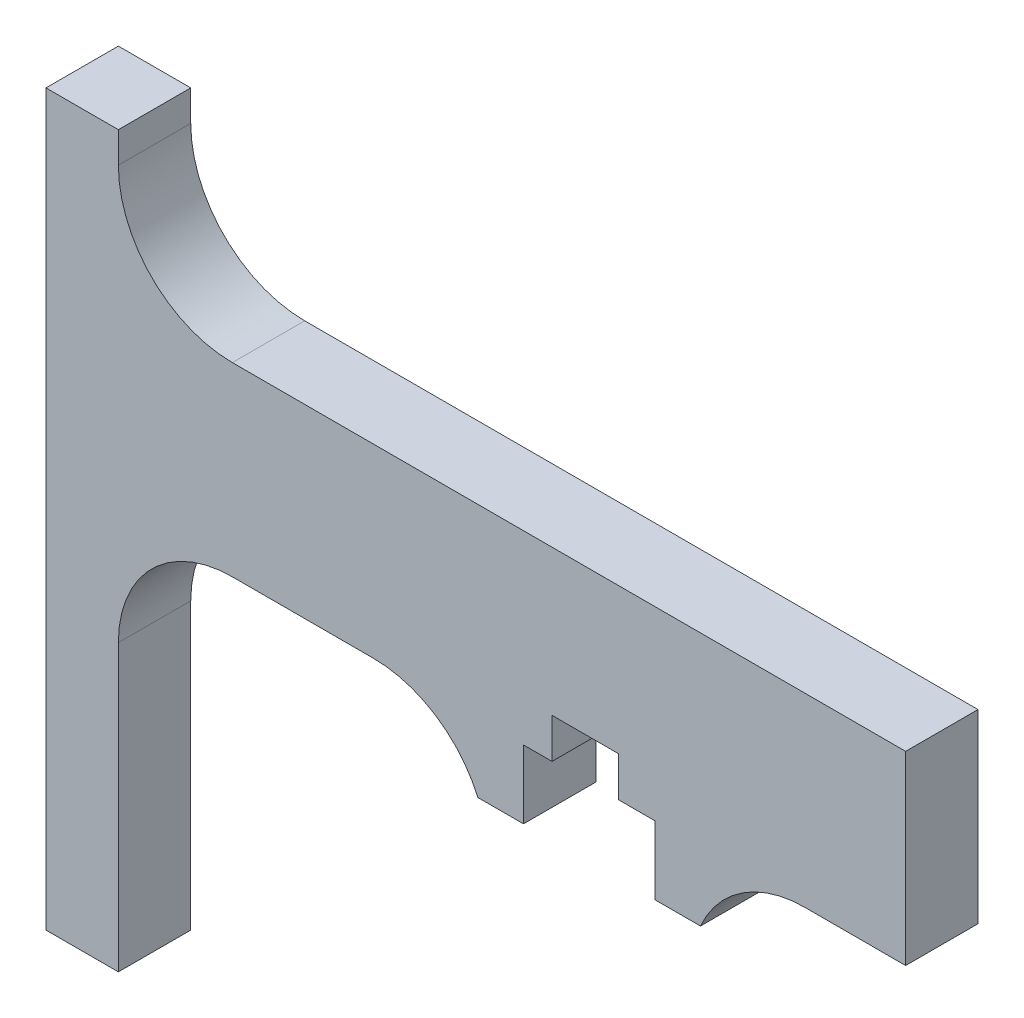
from build123d import *

# Parameters (mm, degrees)
BOSS_EXTRUDE1_DEPTH = 6.35
FILLET1_R           = 10
SKETCH3_W           = 4
SKETCH3_H           = 6
BOSS_EXTRUDE2_DEPTH = 6.35
FILLET2_R           = 10
SKETCH4_W           = 5.85
SKETCH4_H           = 3.5
CUT_EXTRUDE1_DEPTH  = 10


with BuildPart() as part:
    # Sketch2 → Boss-Extrude1 (new body)
    with BuildSketch(Plane.XY):
        Polygon((0, -45.00147748), (0, 0), (6.35, 0), (6.35, -12.7), (75.42710801, -12.7), (75.42710801, -28.978), (6.35, -28.978), (6.35, -63.9998), (0, -63.9998), align=None)
    extrude(amount=BOSS_EXTRUDE1_DEPTH)

    # Fillet1
    fillet1_edges = [part.edges().sort_by_distance(p)[0] for p in [
        (6.35, -12.7, 3.175),
        (6.35, -28.978, 3.175),
    ]]
    fillet(fillet1_edges, radius=FILLET1_R)

    # Sketch3 → Boss-Extrude2 (add)
    with BuildSketch(Plane(origin=(0, 0, 0), x_dir=(-1, 0, 0), z_dir=(0, 0, -1))):
        with Locations((-39.89710801, -31.978)):
            Rectangle(SKETCH3_W, SKETCH3_H)
        with Locations((-55.42710801, -31.978)):
            Rectangle(SKETCH3_W, SKETCH3_H)
    extrude(amount=-BOSS_EXTRUDE2_DEPTH)

    # Fillet2
    # the kernel refuses this fillet: 10 mm, written as the material it adds along each edge
    with BuildSketch(Plane(origin=(57.42710801, -28.978, 0), x_dir=(1, 0, 0), z_dir=(0, 0, 1))) as fillet2_piece_1:
        with BuildLine():
            CenterArc((9.16515139, -10), FILLET2_R, 90, 66.421821522)
            Line((0, -6), (-0.183303028, -5.92))
            ThreePointArc((-0.183303028, -5.92), (-0.2, -3), (-0.2, 0))
            Line((-0.2, 0), (0, 0.2))
            Line((0, 0.2), (9.16515139, 0.2))
            Line((9.16515139, 0.2), (9.16515139, 0))
        make_face()
    extrude(amount=6.35)
    with BuildSketch(Plane(origin=(37.89710801, -28.978, 0), x_dir=(-1, 0, 0), z_dir=(0, 0, 1))) as fillet2_piece_2:
        with BuildLine():
            CenterArc((9.16515139, 10), FILLET2_R, 203.578178478, 66.421821522)
            Line((0, 6), (-0.183303028, 5.92))
            ThreePointArc((-0.183303028, 5.92), (-0.2, 3), (-0.2, 0))
            Line((-0.2, 0), (0, -0.2))
            Line((0, -0.2), (9.16515139, -0.2))
            Line((9.16515139, -0.2), (9.16515139, 0))
        make_face()
    extrude(amount=6.35)

    # Sketch4 → Cut-Extrude1 (cut)
    with BuildSketch(Plane(origin=(0, 0, 0), x_dir=(-1, 0, 0), z_dir=(0, 0, -1))):
        with Locations((-47.32560801, -27.228)):
            Rectangle(SKETCH4_W, SKETCH4_H)
    extrude(amount=-CUT_EXTRUDE1_DEPTH, mode=Mode.SUBTRACT)


solid = part.part
